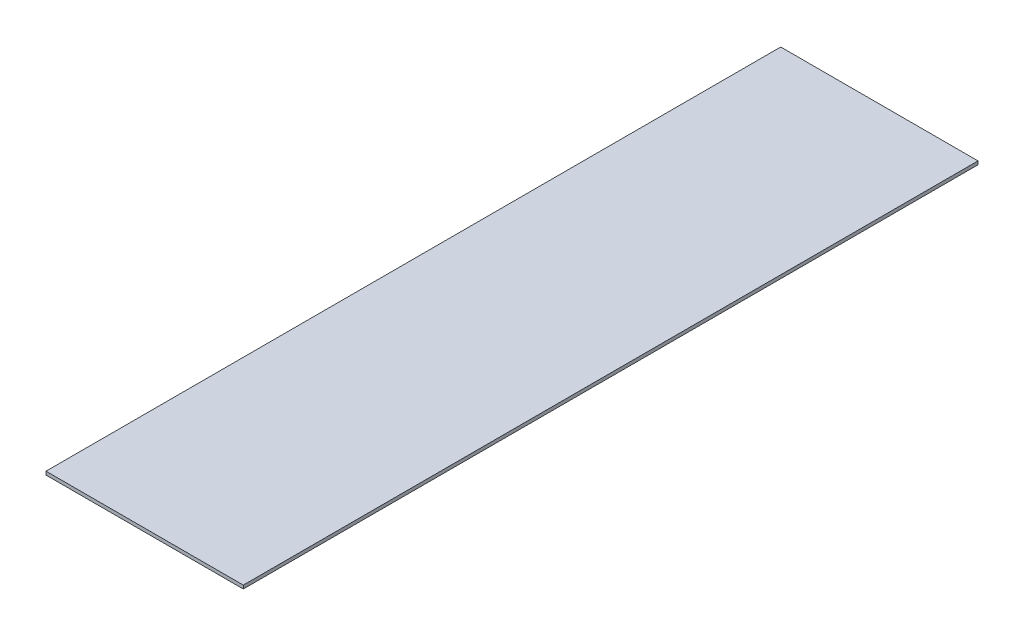
from build123d import *

# Parameters (mm, degrees)
SKETCH1_W           = 184.15
SKETCH1_H           = 685.8
BOSS_EXTRUDE1_DEPTH = 3.175


with BuildPart() as part:
    # Sketch1 → Boss-Extrude1 (new body)
    with BuildSketch(Plane(origin=(0, 0, 0), x_dir=(1, 0, 0), z_dir=(0, 1, 0))):
        with Locations((92.075, 342.9)):
            Rectangle(SKETCH1_W, SKETCH1_H)
    extrude(amount=BOSS_EXTRUDE1_DEPTH)


solid = part.part
